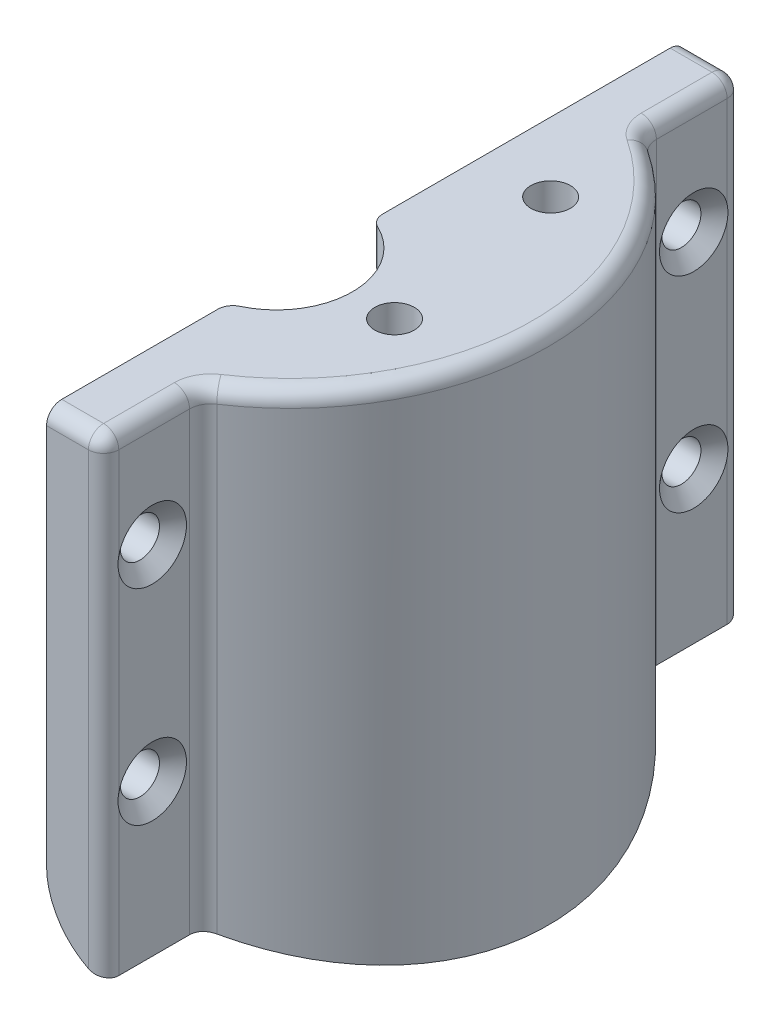
from build123d import *

# Parameters (mm, degrees)
BOSS_EXTRUDE1_DEPTH                       = 43.942
CUT_EXTRUDE1_START                        = -40.767
CUT_EXTRUDE1_DEPTH                        = 40.767
FILLET1_R                                 = 1.27
CSK_FOR_4_FLAT_HEAD_MACHINE_SCREW_2_COUNT = 2
CSK_FOR_4_FLAT_HEAD_MACHINE_SCREW_2_PITCH = 17.1196
CUT_EXTRUDE2_DEPTH                        = 75.354351507
FILLET3_R                                 = 1.778
FILLET4_R                                 = 1.27
FILLET5_R                                 = 6.35
SKETCH8_R                                 = 1.651
CUT_EXTRUDE3_DEPTH                        = 40.767


with BuildPart() as part:
    # Sketch1 → Boss-Extrude1 (new body)
    with BuildSketch(Plane(origin=(0, 0, 0), x_dir=(1, 0, 0), z_dir=(0, 1, 0))):
        with BuildLine():
            Line((12.192, 26.67), (12.192, 0.545071947))
            ThreePointArc((12.192, 0.545071947), (16.556076609, -5.486396223), (12.192, -11.517864393))
            Line((12.192, -11.517864393), (12.192, -26.67))
            Line((12.192, -26.67), (16.9545, -26.67))
            Line((16.9545, -26.67), (16.9545, -19.977285695))
            Line((16.9545, -19.977285695), (16.9545, -18.510549526))
            ThreePointArc((16.9545, -18.510549526), (27.432, 0), (16.9545, 18.510549526))
            Line((16.9545, 18.510549526), (16.9545, 19.977285695))
            Line((16.9545, 19.977285695), (16.9545, 26.67))
            Line((16.9545, 26.67), (12.192, 26.67))
        make_face()
    extrude(amount=-BOSS_EXTRUDE1_DEPTH)

    # Sketch3 → Cut-Extrude1 (cut)
    with BuildSketch(Plane.XZ.offset(43.942).offset(CUT_EXTRUDE1_START)):
        with BuildLine():
            ThreePointArc((12.192, -17.016104372), (23.368, 0), (12.192, 17.016104372))
            Line((12.192, 17.016104372), (12.192, 11.517864393))
            ThreePointArc((12.192, 11.517864393), (16.556076609, 5.486396223), (12.192, -0.545071947))
            Line((12.192, -0.545071947), (12.192, -17.016104372))
        make_face()
    extrude(amount=CUT_EXTRUDE1_DEPTH, mode=Mode.SUBTRACT)

    # Fillet1
    fillet1_edges = [part.edges().sort_by_distance(p)[0] for p in [
        (12.192, -1.5875, -0.545071947),
        (12.192, -1.5875, 11.517864393),
    ]]
    fillet(fillet1_edges, radius=FILLET1_R)

    # Sketch6 → CSK for #4 Flat Head Machine Screw (100)1 (revolve, cut)
    with BuildSketch(Plane(origin=(16.9545, -9.525, 22.606), x_dir=(0, 0, -1), z_dir=(0, 1, 0))):
        Polygon((0, 0), (0, 7.838574487), (1.63195, 6.858), (1.63195, 1.028358553), (2.8575, 0), align=None)
    csk_for_4_flat_head_machine_screw_100 = revolve(axis=Axis((23.3045, -9.525, 22.606), (-1, 0, 0)), mode=Mode.SUBTRACT)

    # CSK for _4 Flat Head Machine Screw _ 2: CSK for #4 Flat Head Machine Screw (100)1 ×2
    with Locations(*[(0, -i * CSK_FOR_4_FLAT_HEAD_MACHINE_SCREW_2_PITCH, 0) for i in range(1, CSK_FOR_4_FLAT_HEAD_MACHINE_SCREW_2_COUNT)]):
        add(csk_for_4_flat_head_machine_screw_100, mode=Mode.SUBTRACT)

    # Mirror1: CSK for #4 Flat Head Machine Screw (100)1 across plane
    add(csk_for_4_flat_head_machine_screw_100.mirror(Plane.XY), mode=Mode.SUBTRACT)

    # Mirror1 copy 1 sketch → Mirror1 copy 1 (revolve, cut)
    with BuildSketch(Plane(origin=(16.9545, -26.6446, -22.606), x_dir=(0, 0, 1), z_dir=(0, 1, 0))):
        Polygon((0, 0), (0, -7.838574487), (1.63195, -6.858), (1.63195, -1.028358553), (2.8575, 0), align=None)
    revolve(axis=Axis((23.3045, -26.6446, -22.606), (1, 0, 0)), mode=Mode.SUBTRACT)

    # Sketch7 → Cut-Extrude2 (cut, through all)
    with BuildSketch(Plane.XY.offset(26.67)):
        Polygon((12.192, -37.563057674), (29.718, -43.942), (12.192, -43.942), align=None)
    extrude(amount=-CUT_EXTRUDE2_DEPTH, mode=Mode.SUBTRACT)

    # Fillet3
    fillet3_edges = [part.edges().sort_by_distance(p)[0] for p in [
        (16.9545, -19.648232957, -18.510549526),
        (16.9545, -19.648232957, 18.510549526),
    ]]
    fillet(fillet3_edges, radius=FILLET3_R)

    # Fillet4
    # the kernel refuses this fillet: 1.27 mm, written as the material it takes off along each edge
    with BuildSketch(Plane(origin=(15.6845, -1.27, -25.4), x_dir=(0, 0, -1), z_dir=(1, 0, 0))) as fillet4_piece_1_section:
        Polygon((0, 0), (FILLET4_R, 0), (FILLET4_R, FILLET4_R), (0, FILLET4_R), align=None)
    fillet4_piece_1 = extrude(amount=FILLET4_R, mode=Mode.PRIVATE)
    fillet4_piece_1 = fillet4_piece_1 - Plane(origin=(15.6845, -1.27, -25.4), x_dir=(0, -0.7071067811865475, 0.7071067811865475), z_dir=(1, 0, 0)) * Sphere(FILLET4_R, mode=Mode.PRIVATE)
    add(fillet4_piece_1, mode=Mode.SUBTRACT)
    with BuildSketch(Plane(origin=(15.6845, -1.27, 25.4), x_dir=(1, 0, 0), z_dir=(0, 0, 1))) as fillet4_piece_2_section:
        Polygon((0, 0), (FILLET4_R, 0), (FILLET4_R, FILLET4_R), (0, FILLET4_R), align=None)
    fillet4_piece_2 = extrude(amount=FILLET4_R, mode=Mode.PRIVATE)
    fillet4_piece_2 = fillet4_piece_2 - Plane(origin=(15.6845, -1.27, 25.4), x_dir=(-0.7071067811865475, -0.7071067811865475, 0), z_dir=(0, 0, 1)) * Sphere(FILLET4_R, mode=Mode.PRIVATE)
    add(fillet4_piece_2, mode=Mode.SUBTRACT)
    with BuildSketch(Plane(origin=(15.6845, 0, -26.67), x_dir=(0, -1, 0), z_dir=(-1, 0, 0)), Plane(origin=(9.017, 0, 26.67), x_dir=(0, -1, 0), z_dir=(1, 0, 0))) as fillet4_piece_3:
        with BuildLine():
            CenterArc((FILLET4_R, FILLET4_R), FILLET4_R, 180, 90)
            Line((0, FILLET4_R), (0, 0))
            Line((0, 0), (FILLET4_R, 0))
        make_face()
    extrude(amount=6.6675, mode=Mode.SUBTRACT)
    with BuildSketch(Plane(origin=(5.842, 0, 0), x_dir=(0.5516304347826092, 0, 0.8340886424245023), z_dir=(-0.8340886424245023, 0, 0.5516304347826092))) as fillet4_piece_4:
        with BuildLine():
            CenterArc((21.59 - FILLET4_R, -FILLET4_R), FILLET4_R, 0, 90)
            Line((21.59 - FILLET4_R, 0), (21.59, 0))
            Line((21.59, 0), (21.59, -FILLET4_R))
        make_face()
    revolve(axis=Axis((5.842, 0, 0), (0, 1, 0)), revolution_arc=113.042120672, mode=Mode.SUBTRACT)
    with BuildSketch(Plane(origin=(16.9545, 0, -25.4), x_dir=(0, -1, 0), z_dir=(0, 0, 1)), Plane(origin=(16.9545, 0, 19.490983396), x_dir=(0, -1, 0), z_dir=(0, 0, 1))) as fillet4_piece_5:
        with BuildLine():
            CenterArc((FILLET4_R, -FILLET4_R), FILLET4_R, 90, 90)
            Line((0, -FILLET4_R), (0, 0))
            Line((0, 0), (FILLET4_R, 0))
        make_face()
    extrude(amount=5.909016604, mode=Mode.SUBTRACT)
    with BuildSketch(Plane(origin=(18.7325, 0, -19.490983396), x_dir=(-0.5516304347826076, 0, 0.8340886424245035), z_dir=(0.8340886424245035, 0, 0.5516304347826076))) as fillet4_piece_6:
        with BuildLine():
            CenterArc((1.778 + FILLET4_R, FILLET4_R), FILLET4_R, 180, 90)
            Line((1.778 + FILLET4_R, 0), (1.778, 0))
            Line((1.778, 0), (1.778, FILLET4_R))
        make_face()
    revolve(axis=Axis((18.7325, 0, -19.490983396), (0, -1, 0)), revolution_arc=56.521060336, mode=Mode.SUBTRACT)
    with BuildSketch(Plane(origin=(18.7325, 0, 19.490983396), x_dir=(-1, 0, 0), z_dir=(0, 0, 1))) as fillet4_piece_7:
        with BuildLine():
            CenterArc((1.778 + FILLET4_R, FILLET4_R), FILLET4_R, 180, 90)
            Line((1.778 + FILLET4_R, 0), (1.778, 0))
            Line((1.778, 0), (1.778, FILLET4_R))
        make_face()
    revolve(axis=Axis((18.7325, 0, 19.490983396), (0, -1, 0)), revolution_arc=56.521060336, mode=Mode.SUBTRACT)
    with BuildSketch(Plane(origin=(16.9545, -1.27, 26.67), x_dir=(0, 0, -1), z_dir=(0, -1, 0))) as fillet4_piece_8:
        with BuildLine():
            CenterArc((FILLET4_R, -FILLET4_R), FILLET4_R, 90, 90)
            Line((0, -FILLET4_R), (0, 0))
            Line((0, 0), (FILLET4_R, 0))
        make_face()
    extrude(amount=41.201465915, mode=Mode.SUBTRACT)
    with BuildSketch(Plane(origin=(16.9545, -1.27, -26.67), x_dir=(0, 0, 1), z_dir=(0, -1, 0))) as fillet4_piece_9:
        with BuildLine():
            CenterArc((FILLET4_R, FILLET4_R), FILLET4_R, 180, 90)
            Line((0, FILLET4_R), (0, 0))
            Line((0, 0), (FILLET4_R, 0))
        make_face()
    extrude(amount=41.201465915, mode=Mode.SUBTRACT)

    # Fillet5
    fillet5_edges = [part.edges().sort_by_distance(p)[0] for p in [
        (12.192, -37.563057674, -21.843052186),
        (12.192, -37.563057674, 21.843052186),
    ]]
    fillet(fillet5_edges, radius=FILLET5_R)

    # Sketch8 → Cut-Extrude3 (cut)
    with BuildSketch(Plane(origin=(0, 0, 0), x_dir=(1, 0, 0), z_dir=(0, 1, 0))):
        with Locations(Location((17.967730782, 9.64524178, 0), (0, 0, 270))):
            Circle(SKETCH8_R)
        with Locations(Location((20.257889798, -5.678570007, 0), (0, 0, 270))):
            Circle(SKETCH8_R)
    extrude(amount=-CUT_EXTRUDE3_DEPTH, mode=Mode.SUBTRACT)


solid = part.part
